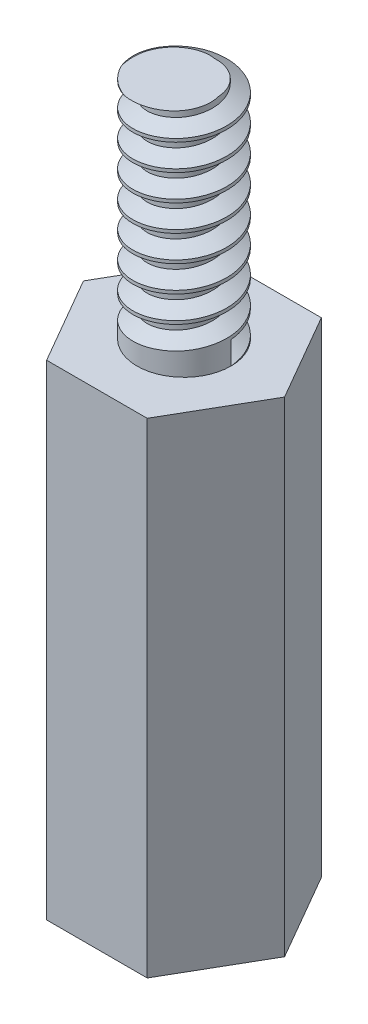
from build123d import *
from build123d.topology import SkipClean

# Parameters (mm, degrees)
BOSS_EXTRUDE1_DEPTH                                = 15
CBORE_FOR_M2_5_PAN_HEAD_MACHINE_SCREW1_D           = 2.9
CBORE_FOR_M2_5_PAN_HEAD_MACHINE_SCREW1_DEPTH       = 12
CBORE_FOR_M2_5_PAN_HEAD_MACHINE_SCREW1_CBORE_D     = 6
CBORE_FOR_M2_5_PAN_HEAD_MACHINE_SCREW1_CBORE_DEPTH = 2.1
CBORE_FOR_M2_5_PAN_HEAD_MACHINE_SCREW1_TIP         = 0.871247898
SKETCH4_R                                          = 1.25
BOSS_EXTRUDE2_DEPTH                                = 6
THREAD1_PITCH                                      = 0.7


with BuildPart() as part:
    # Sketch1 → Boss-Extrude1 (new body)
    with BuildSketch(Plane(origin=(0, 0, 0), x_dir=(1, 0, 0), z_dir=(0, 1, 0))):
        Polygon((1.338153586, -2.31775), (2.676307173, 0), (1.338153586, 2.31775), (-1.338153586, 2.31775), (-2.676307173, 0), (-1.338153586, -2.31775), align=None)
    extrude(amount=BOSS_EXTRUDE1_DEPTH)

    # CBORE for M2.5 Pan Head Machine Screw1
    with Locations(Plane(origin=(0, 0, 0), x_dir=(-1, 0, 0), z_dir=(0, -1, 0))):
        with Locations((0, 0)):
            CounterBoreHole(CBORE_FOR_M2_5_PAN_HEAD_MACHINE_SCREW1_D / 2, CBORE_FOR_M2_5_PAN_HEAD_MACHINE_SCREW1_CBORE_D / 2, CBORE_FOR_M2_5_PAN_HEAD_MACHINE_SCREW1_CBORE_DEPTH, depth=CBORE_FOR_M2_5_PAN_HEAD_MACHINE_SCREW1_DEPTH)
            with Locations((0, 0, -(CBORE_FOR_M2_5_PAN_HEAD_MACHINE_SCREW1_DEPTH + CBORE_FOR_M2_5_PAN_HEAD_MACHINE_SCREW1_TIP / 2))):  # 118° drill point
                Cone(0, CBORE_FOR_M2_5_PAN_HEAD_MACHINE_SCREW1_D / 2, CBORE_FOR_M2_5_PAN_HEAD_MACHINE_SCREW1_TIP, mode=Mode.SUBTRACT)

    # Sketch4 → Boss-Extrude2 (add)
    with BuildSketch(Plane(origin=(0, 15, 0), x_dir=(1, 0, 0), z_dir=(0, 1, 0))):
        with Locations(Location((0, 0, 0), (0, 0, 270))):
            Circle(SKETCH4_R)
    extrude(amount=BOSS_EXTRUDE2_DEPTH)

    # Thread1: the profile of Thread Profile1 profile screwed along a right-hand helix of 14.285714 turns, 6 arcs to a turn; built about Z, then put on its axis
    with SkipClean():  # the faces are left unmerged after this step: merging them gives an invalid solid
        thread1_z = Axis((0, 0, 0), (0, 0, 1))
        thread1_corners = [(1.2503, 0, -0.000173205), (1.2503, 0, 0.612673203), (0.871113888, 0, 0.393749999), (0.871113888, 0, 0.218749999)]
        with BuildLine(mode=Mode.PRIVATE) as thread1_profile:
            Line(thread1_corners[0], thread1_corners[1])
            Line(thread1_corners[1], thread1_corners[2])
            Line(thread1_corners[2], thread1_corners[3])
            Line(thread1_corners[3], thread1_corners[0])
        thread1_cap = Face(thread1_profile.wire())
        thread1_turn_angles = [0, 30, 60, 90, 120, 150, 180, 210, 240, 270, 300, 330, 360]
        thread1_turn_weights = [1, 0.8660254037844387, 1, 0.8660254037844387, 1, 0.8660254037844387, 1, 0.8660254037844387, 1, 0.8660254037844387, 1, 0.8660254037844387, 1]
        thread1_turn_rails = [Edge.make_bspline([Vector(p[0], p[1], 0).rotate(thread1_z, thread1_turn_angles[k]) / thread1_turn_weights[k] + Vector(0, 0, p[2] + THREAD1_PITCH * thread1_turn_angles[k] / 360) for k in range(13)], [0, 0, 0, 1, 1, 2, 2, 3, 3, 4, 4, 5, 5, 6, 6, 6], 2, thread1_turn_weights) for p in thread1_corners]
        thread1_turn_sides = [Face.make_surface_from_curves(thread1_turn_rails[p[0]], thread1_turn_rails[p[1]]) for p in [(0, 1), (1, 2), (2, 3), (3, 0)]]
        thread1_last_angles = [5040, 5070, 5100, 5121.428571429, 5142.857142857]
        thread1_last_weights = [1, 0.8660254037844387, 1, 0.9308737486442035, 1]
        thread1_last_rails = [Edge.make_bspline([Vector(p[0], p[1], 0).rotate(thread1_z, thread1_last_angles[k]) / thread1_last_weights[k] + Vector(0, 0, p[2] + THREAD1_PITCH * thread1_last_angles[k] / 360) for k in range(5)], [0, 0, 0, 1, 1, 2, 2, 2], 2, thread1_last_weights) for p in thread1_corners]
        thread1_last_sides = [Face.make_surface_from_curves(thread1_last_rails[p[0]], thread1_last_rails[p[1]]) for p in [(0, 1), (1, 2), (2, 3), (3, 0)]]
        thread1 = Plane(origin=(0, 15, 0), x_dir=(1, 0, 0), z_dir=(0, 1, 0)) * Solid(Shell([*[p.moved(Location((0, 0, THREAD1_PITCH * i))) for i in range(14) for p in thread1_turn_sides], *thread1_last_sides, thread1_cap, thread1_cap.rotate(thread1_z, 5142.857142857).moved(Location((0, 0, THREAD1_PITCH * 5142.857142857 / 360)))]))
        add(thread1, mode=Mode.SUBTRACT)


solid = part.part
